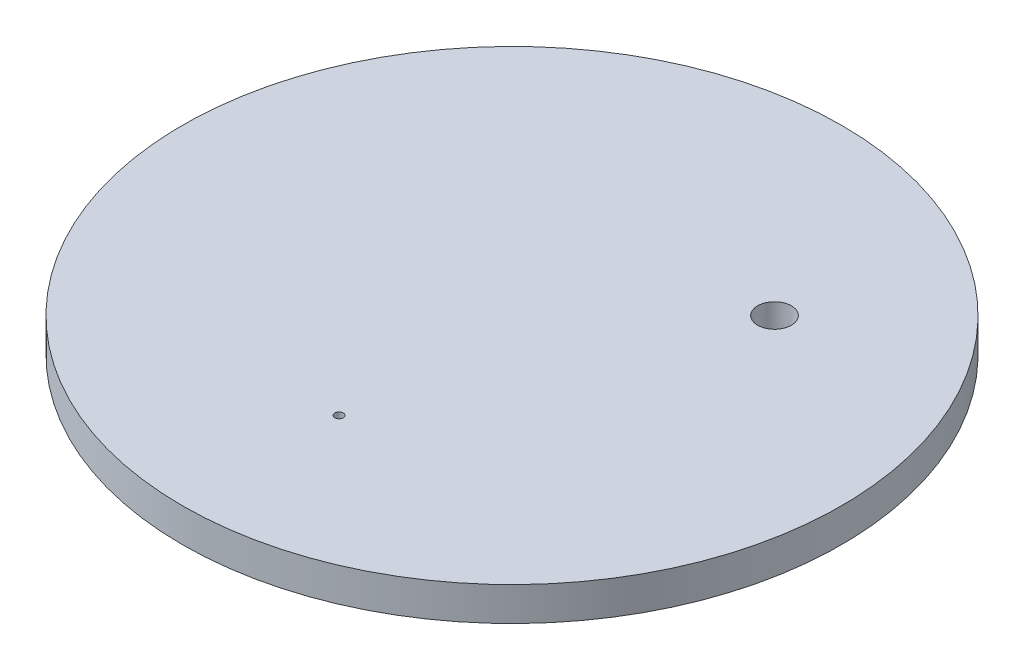
from build123d import *

# Parameters (mm, degrees)
SKETCH1_R               = 19.53
BOSS_EXTRUDE1_DEPTH     = 1
BOSS_EXTRUDE3_START     = 1
SKETCH6_R               = 19.53
SKETCH6_R_2             = 9.525
BOSS_EXTRUDE3_DEPTH     = 1
THREAD1_PITCH           = 0.25
CUT_EXTRUDE1_DEPTH      = 28.691908616
CUT_EXTRUDE1_DEPTH_BACK = 28.691908616
SKETCH7_R               = 0.25
CUT_EXTRUDE2_DEPTH      = 28.691908616
CUT_EXTRUDE2_DEPTH_BACK = 28.691908616
SKETCH8_R               = 1


with BuildPart() as part:
    # Sketch1 → Boss-Extrude1 (new body)
    with BuildSketch(Plane(origin=(0, 0, 0), x_dir=(1, 0, 0), z_dir=(0, 1, 0))):
        with Locations(Location((0, 0, 0), (0, 0, 270))):
            Circle(SKETCH1_R)
    extrude(amount=BOSS_EXTRUDE1_DEPTH)

    # Sketch6 → Boss-Extrude3 (add)
    with BuildSketch(Plane.XZ.offset(BOSS_EXTRUDE3_START)):
        with Locations(Location((0, 0, 0), (0, 0, 270))):
            Circle(SKETCH6_R)
        with Locations(Location((0, 0, 0), (0, 0, 270))):
            Circle(SKETCH6_R_2, mode=Mode.SUBTRACT)
    extrude(amount=-BOSS_EXTRUDE3_DEPTH)

    # Thread1: the profile of Thread Profile1 profile screwed along a right-hand helix of 4 turns, 6 arcs to a turn; built about Z, then put on its axis
    thread1_z = Axis((0, 0, 0), (0, 0, 1))
    thread1_corners = [(9.5247, 0, -0.000173205), (9.660316469, 0, 0.078125), (9.660316469, 0, 0.109375), (9.5247, 0, 0.187673204)]
    with BuildLine(mode=Mode.PRIVATE) as thread1_profile:
        Line(thread1_corners[0], thread1_corners[1])
        Line(thread1_corners[1], thread1_corners[2])
        Line(thread1_corners[2], thread1_corners[3])
        Line(thread1_corners[3], thread1_corners[0])
    thread1_cap = Face(thread1_profile.wire())
    thread1_turn_angles = [0, 30, 60, 90, 120, 150, 180, 210, 240, 270, 300, 330, 360]
    thread1_turn_weights = [1, 0.8660254037844387, 1, 0.8660254037844387, 1, 0.8660254037844387, 1, 0.8660254037844387, 1, 0.8660254037844387, 1, 0.8660254037844387, 1]
    thread1_turn_rails = [Edge.make_bspline([Vector(p[0], p[1], 0).rotate(thread1_z, thread1_turn_angles[k]) / thread1_turn_weights[k] + Vector(0, 0, p[2] + THREAD1_PITCH * thread1_turn_angles[k] / 360) for k in range(13)], [0, 0, 0, 1, 1, 2, 2, 3, 3, 4, 4, 5, 5, 6, 6, 6], 2, thread1_turn_weights) for p in thread1_corners]
    thread1_turn_sides = [Face.make_surface_from_curves(thread1_turn_rails[p[0]], thread1_turn_rails[p[1]]) for p in [(0, 1), (1, 2), (2, 3), (3, 0)]]
    thread1 = Plane(origin=(0, -1, 0), x_dir=(1, 0, 0), z_dir=(0, 1, 0)) * Solid(Shell([*[p.moved(Location((0, 0, THREAD1_PITCH * i))) for i in range(4) for p in thread1_turn_sides], thread1_cap, thread1_cap.rotate(thread1_z, 1440).moved(Location((0, 0, THREAD1_PITCH * 1440 / 360)))]))
    add(thread1, mode=Mode.SUBTRACT)

    # Sketch7 → Cut-Extrude1 (cut, two sides: drawn at the far end of the back side and taken through both)
    with BuildSketch(Plane(origin=(0, 1, 0), x_dir=(1, 0, 0), z_dir=(0, 1, 0)).offset(-CUT_EXTRUDE1_DEPTH_BACK)):
        with Locations(Location((0, -10.25, 0), (0, 0, 270))):
            Circle(SKETCH7_R)
    extrude(amount=CUT_EXTRUDE1_DEPTH + CUT_EXTRUDE1_DEPTH_BACK, mode=Mode.SUBTRACT)

    # Sketch8 → Cut-Extrude2 (cut, two sides: drawn at the far end of the back side and taken through both)
    with BuildSketch(Plane(origin=(0, 1, 0), x_dir=(1, 0, 0), z_dir=(0, 1, 0)).offset(-CUT_EXTRUDE2_DEPTH_BACK)):
        with Locations(Location((7.778174593, 7.778174593, 0), (0, 0, 270))):
            Circle(SKETCH8_R)
    extrude(amount=CUT_EXTRUDE2_DEPTH + CUT_EXTRUDE2_DEPTH_BACK, mode=Mode.SUBTRACT)


solid = part.part
